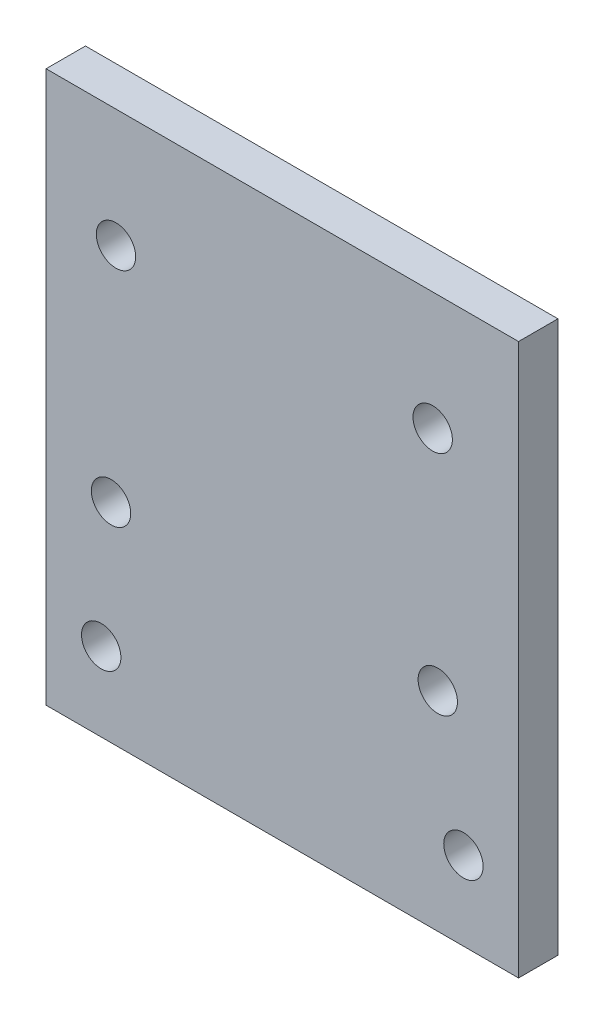
from build123d import *

# Parameters (mm, degrees)
SKETCH1_W           = 60
SKETCH1_H           = 70
SKETCH1_R           = 2.5
BOSS_EXTRUDE1_DEPTH = 5


with BuildPart() as part:
    # Sketch1 → Boss-Extrude1 (new body)
    with BuildSketch(Plane.XY):
        with Locations((30, -35)):
            Rectangle(SKETCH1_W, SKETCH1_H)
        with Locations((8.879726404, -15)):
            Circle(SKETCH1_R, mode=Mode.SUBTRACT)
        with Locations((49.096380092, -15)):
            Circle(SKETCH1_R, mode=Mode.SUBTRACT)
        with Locations((49.743242135, -43.54)):
            Circle(SKETCH1_R, mode=Mode.SUBTRACT)
        with Locations((8.252207519, -43.54)):
            Circle(SKETCH1_R, mode=Mode.SUBTRACT)
        with Locations((7, -60)):
            Circle(SKETCH1_R, mode=Mode.SUBTRACT)
        with Locations((53, -60)):
            Circle(SKETCH1_R, mode=Mode.SUBTRACT)
    extrude(amount=BOSS_EXTRUDE1_DEPTH)


solid = part.part
